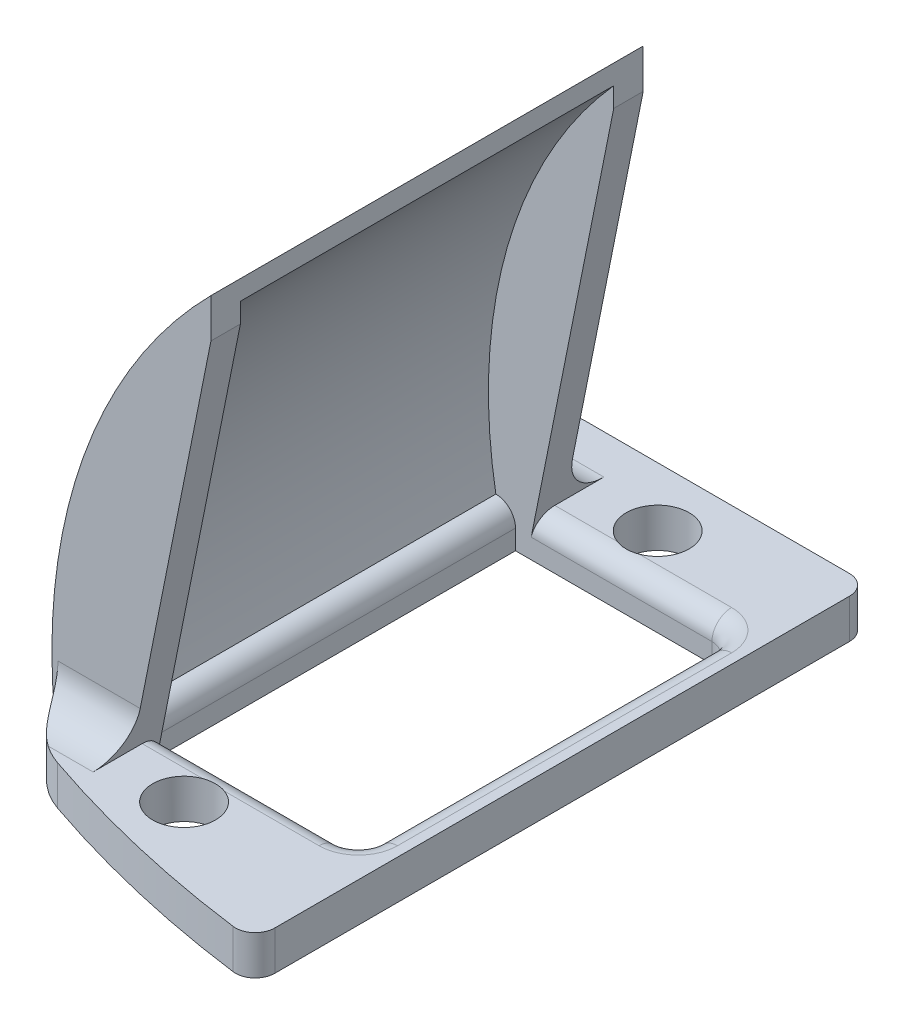
from build123d import *

# Parameters (mm, degrees)
SKETCH1_W                = 11
SKETCH1_H                = 19
BOSS_EXTRUDE1_DEPTH      = 2
BOSS_EXTRUDE2_DEPTH      = 11
BOSS_EXTRUDE2_DEPTH_BACK = 11
BOSS_EXTRUDE3_DEPTH      = 1.5
BOSS_EXTRUDE4_START      = -22
BOSS_EXTRUDE4_DEPTH      = 1.5
SKETCH4_R                = 1.6
CUT_EXTRUDE1_DEPTH       = 41.722097522
FILLET1_R                = 4
FILLET2_R                = 1
FILLET3_R                = 2


with BuildPart() as part:
    # Sketch1 → Boss-Extrude1 (new body)
    with BuildSketch(Plane(origin=(0, 0, 0), x_dir=(1, 0, 0), z_dir=(0, 1, 0))):
        with BuildLine():
            Line((-0.004910497, 3.064545275), (-0.004910497, 30.564545275))
            Line((-0.004910497, 30.564545275), (15.495089503, 30.564545275))
            Line((15.495089503, 30.564545275), (15.495089503, -0.81352161))
            ThreePointArc((15.495089503, -0.81352161), (7.615422876, 0.607255499), (-0.004910497, 3.064545275))
        make_face()
        with Locations((8.495089503, 15.564545275)):
            Rectangle(SKETCH1_W, SKETCH1_H, mode=Mode.SUBTRACT)
    extrude(amount=BOSS_EXTRUDE1_DEPTH)

    # Sketch2 → Boss-Extrude2 (add, two sides: drawn at the far end of the back side and taken through both)
    with BuildSketch(Plane.XY.offset(-15.564545275).offset(-BOSS_EXTRUDE2_DEPTH_BACK)):
        with BuildLine():
            Line((7.995089503, 24), (7.995089503, 23))
            ThreePointArc((7.995089503, 23), (2.580593395, 13.189856031), (1.995089503, 2))
            Line((1.995089503, 2), (-0.004910497, 2))
            ThreePointArc((-0.004910497, 2), (1.585642128, 13.876162682), (7.995089503, 24))
        make_face()
    extrude(amount=BOSS_EXTRUDE2_DEPTH + BOSS_EXTRUDE2_DEPTH_BACK)

    # Sketch3 → Boss-Extrude3 (add)
    with BuildSketch(Plane.XY.offset(-4.564545275)):
        with BuildLine():
            Line((7.995089503, 24), (7.995089503, 22))
            Line((7.995089503, 22), (3.995089503, 2))
            Line((3.995089503, 2), (-0.004910497, 2))
            ThreePointArc((-0.004910497, 2), (1.760688004, 13.812509636), (7.995089503, 24))
        make_face()
    extrude(amount=-BOSS_EXTRUDE3_DEPTH)

    # Sketch3<2> → Boss-Extrude4 (add)
    with BuildSketch(Plane.XY.offset(-4.564545275).offset(BOSS_EXTRUDE4_START)):
        with BuildLine():
            Line((7.995089503, 24), (7.995089503, 22))
            Line((7.995089503, 22), (3.995089503, 2))
            Line((3.995089503, 2), (-0.004910497, 2))
            ThreePointArc((-0.004910497, 2), (1.760688004, 13.812509636), (7.995089503, 24))
        make_face()
    extrude(amount=BOSS_EXTRUDE4_DEPTH)

    # Sketch4 → Cut-Extrude1 (cut, through all)
    with BuildSketch(Plane(origin=(0, 2, 0), x_dir=(1, 0, 0), z_dir=(0, 1, 0))):
        with Locations(Location((7.732104354, 27.564545275, 0), (0, 0, 270))):
            Circle(SKETCH4_R)
        with Locations(Location((7.628223159, 3.564545275, 0), (0, 0, 270))):
            Circle(SKETCH4_R)
    extrude(amount=-CUT_EXTRUDE1_DEPTH, mode=Mode.SUBTRACT)

    # Fillet1
    # the kernel refuses this fillet: 4 mm, written as the material it takes off along each edge
    with BuildSketch(Plane(origin=(-0.004910497, -7.201261458, -3.064545275), x_dir=(0, 0, -1), z_dir=(0, 1, 0))) as fillet1_piece_1_section:
        with BuildLine():
            CenterArc((2.782831809, -4), FILLET1_R, 90, 71.052480457)
            ThreePointArc((-1.000433732, -2.701192145), (-0.516429194, -1.344591553), (0, 0))
            Line((0, 0), (2.782831809, 0))
        make_face()
    fillet1_piece_1 = extrude(amount=16.402522916, mode=Mode.PRIVATE)
    fillet1_piece_1 = fillet1_piece_1 - Plane(origin=(27.899857986, 4.307356915, -4.929207358), x_dir=(-0.9965988743768334, -0.08240560412271017, 0), z_dir=(0, 0, -1)) * Cylinder(28, 44, mode=Mode.PRIVATE)
    add(fillet1_piece_1, mode=Mode.SUBTRACT)
    with BuildSketch(Plane(origin=(-0.004910497, -7.201261458, -3.064545275), x_dir=(0, 0, -1), z_dir=(0, 1, 0))) as fillet1_piece_2_section:
        with BuildLine():
            CenterArc((2.782831809, -4), FILLET1_R, 90, 71.052480457)
            ThreePointArc((-1.000433732, -2.701192145), (-0.516429194, -1.344591553), (0, 0))
            Line((0, 0), (2.782831809, 0))
        make_face()
    fillet1_piece_2 = extrude(amount=16.402522916, mode=Mode.PRIVATE)
    fillet1_piece_2 = split(fillet1_piece_2, bisect_by=Plane(origin=(0.675993318, 1.051688324, -4.564545275), z_dir=(0, 0, 1)), keep=Keep.TOP, mode=Mode.PRIVATE)
    add(fillet1_piece_2, mode=Mode.SUBTRACT)

    # Fillet2
    # the kernel refuses this fillet: 1 mm, written as the material it adds along each edge
    with BuildSketch(Plane(origin=(13.995089503, 0, -6.064545275), x_dir=(0, 0, -1), z_dir=(0, 1, 0)), Plane(origin=(13.995089503, 0, -25.064545275), x_dir=(-1, 0, 0), z_dir=(0, 1, 0))) as fillet2_piece_1:
        with BuildLine():
            CenterArc((FILLET2_R, FILLET2_R), FILLET2_R, 180, 90)
            Line((0, FILLET2_R), (0, 0))
            Line((0, 0), (FILLET2_R, 0))
        make_face()
    extrude(amount=2)
    # the kernel refuses this fillet: 1 mm, written as the material it takes off along each edge
    with BuildSketch(Plane(origin=(2.995089503, 2, -6.064545275), x_dir=(0, -1, 0), z_dir=(0, 0, -1))) as fillet2_2_piece_1:
        with BuildLine():
            CenterArc((FILLET2_R, FILLET2_R), FILLET2_R, 180, 90)
            Line((0, FILLET2_R), (0, 0))
            Line((0, 0), (FILLET2_R, 0))
        make_face()
    extrude(amount=19, mode=Mode.SUBTRACT)
    with BuildSketch(Plane(origin=(-0.004910497, -2.5, -30.564545275), x_dir=(0, 0, 1), z_dir=(0, 1, 0)), Plane(origin=(15.495089503, -2.5, -30.564545275), x_dir=(-1, 0, 0), z_dir=(0, 1, 0))) as fillet2_2_piece_2:
        with BuildLine():
            CenterArc((FILLET2_R, FILLET2_R), FILLET2_R, 180, 90)
            Line((0, FILLET2_R), (0, 0))
            Line((0, 0), (FILLET2_R, 0))
        make_face()
    extrude(amount=7, mode=Mode.SUBTRACT)
    with BuildSketch(Plane(origin=(15.495089503, -2.846412971, 0.81352161), x_dir=(0, 0, -1), z_dir=(0, 1, 0))) as fillet2_2_piece_3:
        with BuildLine():
            CenterArc((1.129037279, 1), FILLET2_R, 172.517371348, 97.482628652)
            ThreePointArc((0.137552889, 1.130225593), (0.066095477, 0.565439081), (0, 0))
            Line((0, 0), (1.129037279, 0))
        make_face()
    extrude(amount=7.692825941, mode=Mode.SUBTRACT)
    # the kernel refuses this fillet: 1 mm, written as the material it takes off along each edge
    with BuildSketch(Plane(origin=(12.995089503, 2, -6.064545275), x_dir=(0, 0, 1), z_dir=(-1, 0, 0))) as fillet2_3_piece_1_section:
        with BuildLine():
            CenterArc((FILLET2_R, -FILLET2_R), FILLET2_R, 90, 90)
            Line((0, -FILLET2_R), (0, 0))
            Line((0, 0), (FILLET2_R, 0))
        make_face()
    fillet2_3_piece_1 = extrude(amount=11.5, mode=Mode.PRIVATE)
    fillet2_3_piece_1 = split(fillet2_3_piece_1, bisect_by=Plane(origin=(4.123556577, 2.642335372, -5.838757255), z_dir=(0.9805806756909202, -0.19611613513818374, 0)), keep=Keep.TOP, mode=Mode.PRIVATE)
    add(fillet2_3_piece_1, mode=Mode.SUBTRACT)
    with BuildSketch(Plane(origin=(1.495089503, 2, -25.064545275), x_dir=(0, 0, -1), z_dir=(1, 0, 0))) as fillet2_3_piece_2_section:
        with BuildLine():
            CenterArc((FILLET2_R, -FILLET2_R), FILLET2_R, 90, 90)
            Line((0, -FILLET2_R), (0, 0))
            Line((0, 0), (FILLET2_R, 0))
        make_face()
    fillet2_3_piece_2 = extrude(amount=11.5, mode=Mode.PRIVATE)
    fillet2_3_piece_2 = split(fillet2_3_piece_2, bisect_by=Plane(origin=(4.123556577, 2.642335372, -25.290333294), z_dir=(0.9805806756909202, -0.19611613513818374, 0)), keep=Keep.TOP, mode=Mode.PRIVATE)
    add(fillet2_3_piece_2, mode=Mode.SUBTRACT)
    with BuildSketch(Plane(origin=(13.995089503, 2, -24.064545275), x_dir=(1, 0, 0), z_dir=(0, 0, 1))) as fillet2_3_piece_3:
        with BuildLine():
            CenterArc((FILLET2_R, -FILLET2_R), FILLET2_R, 90, 90)
            Line((0, -FILLET2_R), (0, 0))
            Line((0, 0), (FILLET2_R, 0))
        make_face()
    extrude(amount=17, mode=Mode.SUBTRACT)
    with BuildSketch(Plane(origin=(12.995089503, 2, -24.064545275), x_dir=(0, 0, -1), z_dir=(-1, 0, 0))) as fillet2_3_piece_4:
        with BuildLine():
            CenterArc((1 + FILLET2_R, FILLET2_R), FILLET2_R, 180, 90)
            Line((1, FILLET2_R), (1, 0))
            Line((1, 0), (1 + FILLET2_R, 0))
        make_face()
    revolve(axis=Axis((12.995089503, 2, -24.064545275), (0, -1, 0)), revolution_arc=90, mode=Mode.SUBTRACT)
    with BuildSketch(Plane(origin=(12.995089503, 2, -7.064545275), x_dir=(1, 0, 0), z_dir=(0, 0, -1))) as fillet2_3_piece_5:
        with BuildLine():
            CenterArc((1 + FILLET2_R, FILLET2_R), FILLET2_R, 180, 90)
            Line((1, FILLET2_R), (1, 0))
            Line((1, 0), (1 + FILLET2_R, 0))
        make_face()
    revolve(axis=Axis((12.995089503, 2, -7.064545275), (0, -1, 0)), revolution_arc=90, mode=Mode.SUBTRACT)

    # Fillet3
    # the kernel refuses this fillet: 2 mm, written as the material it adds along each edge
    with BuildSketch(Plane(origin=(8.995089503, 2, -4.564545275), x_dir=(0, 0, 1), z_dir=(-1, 0, 0))) as fillet3_piece_1_section:
        with BuildLine():
            CenterArc((FILLET3_R, FILLET3_R), FILLET3_R, 180, 90)
            Line((0, FILLET3_R), (0, 0))
            Line((0, 0), (FILLET3_R, 0))
        make_face()
    fillet3_piece_1 = extrude(amount=13.788712519, mode=Mode.PRIVATE)
    fillet3_piece_1 = fillet3_piece_1 & Plane(origin=(3.995089503, 2.466350157, -5.847377084), x_dir=(0, 0, -1), z_dir=(0, -1, 0)) * Cylinder(4, 36, mode=Mode.PRIVATE)
    fillet3_piece_1 = split(fillet3_piece_1, bisect_by=Plane(origin=(4.017419709, 2.111651029, -4.143772398), z_dir=(-0.9805806756909202, 0.19611613513818374, 0)), keep=Keep.TOP, mode=Mode.PRIVATE)
    add(fillet3_piece_1)
    with BuildSketch(Plane(origin=(-5.004910497, 2, -26.564545275), x_dir=(0, 0, -1), z_dir=(1, 0, 0))) as fillet3_piece_2_section:
        with BuildLine():
            CenterArc((FILLET3_R, FILLET3_R), FILLET3_R, 180, 90)
            Line((0, FILLET3_R), (0, 0))
            Line((0, 0), (FILLET3_R, 0))
        make_face()
    fillet3_piece_2 = extrude(amount=14, mode=Mode.PRIVATE)
    fillet3_piece_2 = fillet3_piece_2 & Plane(origin=(27.899857986, 4.307356915, -26.843512553), x_dir=(-0.9965988743768334, -0.08240560412271017, 0), z_dir=(0, 0, -1)) * Cylinder(28, 36, mode=Mode.PRIVATE)
    fillet3_piece_2 = split(fillet3_piece_2, bisect_by=Plane(origin=(3.978687185, 1.91798841, -26.843512553), z_dir=(-0.9805806756909202, 0.19611613513818374, 0)), keep=Keep.TOP, mode=Mode.PRIVATE)
    add(fillet3_piece_2)


solid = part.part
